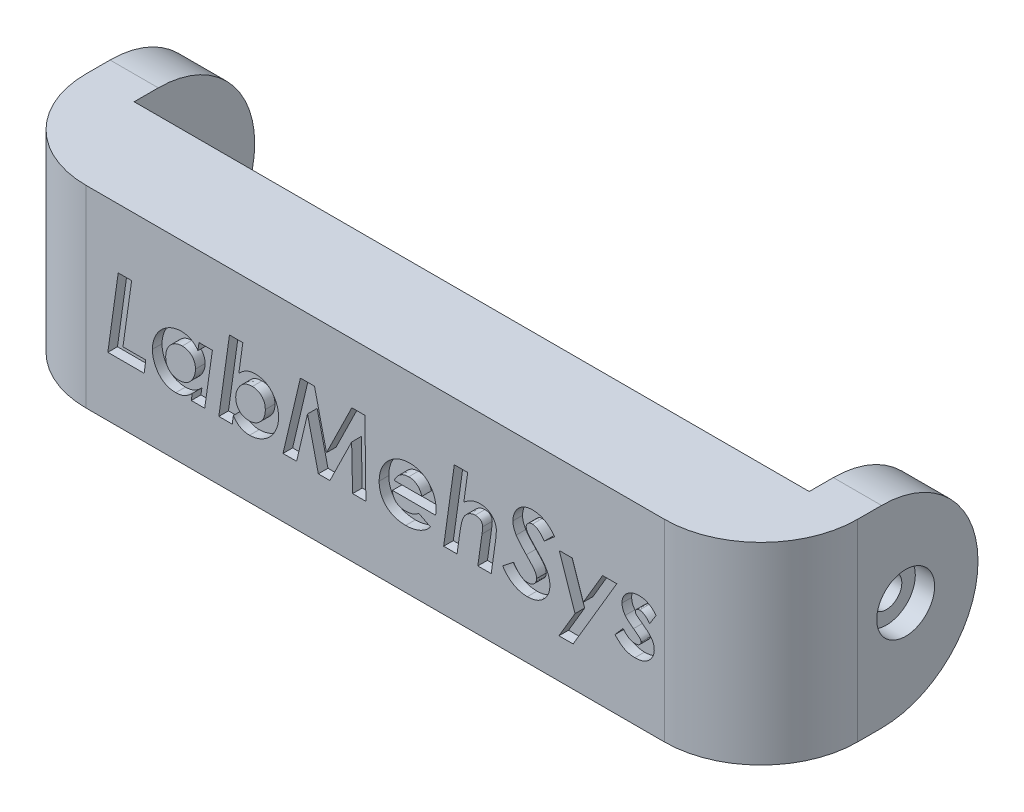
from build123d import *

# Parameters (mm, degrees)
SKETCH1_W           = 70
SKETCH1_H           = 10
BOSS_EXTRUDE1_DEPTH = 20
FILLET1_R           = 10
FILLET2_R           = 10
SKETCH4_R           = 1.6
CUT_EXTRUDE2_DEPTH  = 94
SKETCH5_R           = 3
CUT_EXTRUDE3_DEPTH  = 2
CUT_EXTRUDE4_START  = -2
SKETCH6_R           = 3
CUT_EXTRUDE4_DEPTH  = 2
CUT_EXTRUDE5_DEPTH  = 1


with BuildPart() as part:
    # Sketch1 → Boss-Extrude1 (new body)
    with BuildSketch(Plane(origin=(0, 0, 0), x_dir=(1, 0, 0), z_dir=(0, 1, 0))):
        Polygon((-34.024767802, -4.690402477), (-34.024767802, 5.309597523), (-34.024767802, 17.809597523), (-39.024767802, 17.809597523), (-39.024767802, -4.690402477), align=None)
        with Locations((0.975232198, 0.309597523)):
            Rectangle(SKETCH1_W, SKETCH1_H)
        Polygon((35.975232198, 17.809597523), (35.975232198, 5.309597523), (35.975232198, -4.690402477), (40.975232198, -4.690402477), (40.975232198, 17.809597523), align=None)
    extrude(amount=BOSS_EXTRUDE1_DEPTH)

    # Fillet1
    fillet1_edges = [part.edges().sort_by_distance(p)[0] for p in [
        (40.975232198, 10, 4.690402477),
        (-39.024767802, 10, 4.690402477),
    ]]
    fillet(fillet1_edges, radius=FILLET1_R)

    # Fillet2
    fillet2_edges = [part.edges().sort_by_distance(p)[0] for p in [
        (-36.524767802, 0, -17.809597523),
        (-36.524767802, 20, -17.809597523),
        (38.475232198, 0, -17.809597523),
        (38.475232198, 20, -17.809597523),
    ]]
    fillet(fillet2_edges, radius=FILLET2_R - 0.0001)  # a hair under: the kernel refuses the full size

    # Sketch4 → Cut-Extrude2 (cut)
    with BuildSketch(Plane(origin=(40.975232198, 0, 0), x_dir=(0, 0, -1), z_dir=(1, 0, 0))):
        with Locations((10.309597523, 10)):
            Circle(SKETCH4_R)
    extrude(amount=-CUT_EXTRUDE2_DEPTH, mode=Mode.SUBTRACT)

    # Sketch5 → Cut-Extrude3 (cut)
    with BuildSketch(Plane.ZY.offset(39.024767802)):
        with Locations((-10.309597523, 10)):
            Circle(SKETCH5_R)
    extrude(amount=-CUT_EXTRUDE3_DEPTH, mode=Mode.SUBTRACT)

    # Sketch6 → Cut-Extrude4 (cut)
    with BuildSketch(Plane(origin=(40.975232198, 0, 0), x_dir=(0, 0, -1), z_dir=(1, 0, 0)).offset(CUT_EXTRUDE4_START)):
        with Locations(Location((10.309597523, 10, 0), (0, 0, 180))):
            Circle(SKETCH6_R)
    extrude(amount=CUT_EXTRUDE4_DEPTH, mode=Mode.SUBTRACT)

    # Sketch7 → Cut-Extrude5 (cut)
    # profile 1 of 9: a face of its own
    with BuildSketch(Plane.XY.offset(4.690402477)):
        Polygon((-25.679774562, 13.80675238), (-24.288751007, 13.80675238), (-25.186383887, 7.412655158), (-22.820875323, 7.412655158), (-22.986875924, 6.133835714), (-26.755704383, 6.133835714), align=None)
    # profile 2 of 9: a face of its own
    with BuildSketch(Plane.XY.offset(4.690402477)):
        with BuildLine():
            Line((-17.302892383, 11.740967124), (-15.913405872, 11.740967124))
            Line((-15.913405872, 11.740967124), (-16.709593939, 6.133835714))
            Line((-16.709593939, 6.133835714), (-18.099080451, 6.133835714))
            Line((-18.099080451, 6.133835714), (-18.002246767, 6.819356714))
            add(Edge.make_bspline(
                [(-18.002246767, 6.819356714), (-18.074496335, 6.750584947), (-18.212263445, 6.619449386), (-18.425640223, 6.449322627), (-18.63104036, 6.310962019), (-18.833541739, 6.20484122), (-19.038706507, 6.127848867), (-19.251668172, 6.074521521), (-19.476757032, 6.04116968), (-19.630879939, 6.037398519), (-19.709901097, 6.035464987)],
                knots=[0, 0, 0, 0, 1.236324186, 2.357450916, 3.379388742, 4.30284698, 5.185433758, 6.089881904, 7.020653398, 8, 8, 8, 8], degree=3))
            add(Edge.make_bspline(
                [(-19.709901097, 6.035464987), (-19.80022409, 6.037569185), (-19.977116908, 6.041690146), (-20.235154703, 6.081568965), (-20.479092386, 6.143938585), (-20.709044832, 6.231944025), (-20.923769529, 6.346816129), (-21.125322243, 6.486068632), (-21.311880353, 6.651415752), (-21.480885291, 6.840670367), (-21.633301904, 7.044650699), (-21.765873624, 7.260198283), (-21.880988128, 7.482269972), (-21.970586977, 7.71492278), (-22.04454995, 7.953805634), (-22.094063524, 8.202104525), (-22.126003375, 8.458036711), (-22.130171758, 8.631432952), (-22.132280237, 8.71914137)],
                knots=[0, 0, 0, 0, 1.072254913, 2.099954687, 3.093402483, 4.05863531, 5.017013142, 5.979305845, 6.962352722, 7.970695896, 8.988290287, 9.983079422, 10.973839091, 11.95483031, 12.940586347, 13.940815436, 14.958409826, 16, 16, 16, 16], degree=3))
            add(Edge.make_bspline(
                [(-22.132280237, 8.71914137), (-22.131222283, 8.786820541), (-22.129117688, 8.921455148), (-22.108331259, 9.122278141), (-22.074462346, 9.320366441), (-22.027946165, 9.516377378), (-21.969964308, 9.710257212), (-21.897483006, 9.90130915), (-21.810539716, 10.089148502), (-21.712811407, 10.274000117), (-21.604940159, 10.453634515), (-21.483932772, 10.622237014), (-21.35690779, 10.782888938), (-21.219790704, 10.932440338), (-21.072927085, 11.070402997), (-20.919344383, 11.201127322), (-20.754097165, 11.31828006), (-20.58300429, 11.427979954), (-20.40507194, 11.523498469), (-20.225122221, 11.60933553), (-20.041765156, 11.679310534), (-19.85731304, 11.73854481), (-19.67015801, 11.783026969), (-19.481213889, 11.815000905), (-19.290258591, 11.836220276), (-19.162257296, 11.838297593), (-19.098158142, 11.839337851)],
                knots=[0, 0, 0, 0, 1.010861959, 2.01091412, 3.012605424, 4.011485121, 5.018863341, 6.033918867, 7.061452407, 8.109228878, 9.15680961, 10.18900835, 11.207521355, 12.215190347, 13.216881651, 14.216552911, 15.225616441, 16.240671966, 17.251099115, 18.240697123, 19.217272556, 20.180771028, 21.133199006, 22.08832996, 23.042693801, 24, 24, 24, 24], degree=3))
            add(Edge.make_bspline(
                [(-19.098158142, 11.839337851), (-19.012914431, 11.836909236), (-18.844886844, 11.832122088), (-18.598785865, 11.787246223), (-18.363025734, 11.716270037), (-18.138190032, 11.61784434), (-17.92704188, 11.492428227), (-17.735747171, 11.33794153), (-17.559983546, 11.1608642), (-17.463909731, 11.023694546), (-17.415096493, 10.954001312)],
                knots=[0, 0, 0, 0, 1.030509072, 2.031281277, 3.015697838, 4.003854478, 4.993584726, 5.977161716, 6.972235198, 8, 8, 8, 8], degree=3))
            Line((-17.415096493, 10.954001312), (-17.302892383, 11.740967124))
        make_face()
        with BuildLine():
            add(Edge.make_bspline(
                [(-19.400955534, 7.314284432), (-19.320831154, 7.316760961), (-19.164573661, 7.321590654), (-18.938823431, 7.364373922), (-18.728455632, 7.431746551), (-18.533788137, 7.528055869), (-18.354151491, 7.654722612), (-18.191093719, 7.812812236), (-18.043818113, 8.002192586), (-17.914659909, 8.217157997), (-17.806718547, 8.448351412), (-17.727631653, 8.687032819), (-17.677195812, 8.928620998), (-17.671533253, 9.09137846), (-17.668708523, 9.172568937)],
                knots=[0, 0, 0, 0, 1.017901168, 1.985097214, 2.910041334, 3.818973104, 4.735274743, 5.693545178, 6.695670165, 7.777101795, 8.875856117, 9.932619244, 10.968700869, 12, 12, 12, 12], degree=3))
            add(Edge.make_bspline(
                [(-17.668708523, 9.172568937), (-17.670000719, 9.223332908), (-17.672540168, 9.323095266), (-17.68913987, 9.468777569), (-17.718321072, 9.606782009), (-17.760191064, 9.737023331), (-17.813673689, 9.859641602), (-17.87916532, 9.974996291), (-17.955730796, 10.08227969), (-18.043736878, 10.181400165), (-18.142083922, 10.269216783), (-18.246359109, 10.349724824), (-18.361410113, 10.412943653), (-18.481660075, 10.468109756), (-18.610395035, 10.508802112), (-18.745863, 10.540507738), (-18.889756732, 10.556622976), (-18.987970904, 10.559200066), (-19.038213481, 10.560518406)],
                knots=[0, 0, 0, 0, 1.109141645, 2.179707075, 3.198451464, 4.18615572, 5.163657463, 6.116161664, 7.079133258, 8.038519567, 9.005387219, 9.956904198, 10.909408399, 11.866440704, 12.843493655, 13.853714903, 14.902043453, 16, 16, 16, 16], degree=3))
            add(Edge.make_bspline(
                [(-19.038213481, 10.560518406), (-19.096721006, 10.559241298), (-19.21222245, 10.556720122), (-19.381950436, 10.530681223), (-19.545653549, 10.491801949), (-19.701746807, 10.433620871), (-19.851858865, 10.361911465), (-19.993655584, 10.271311427), (-20.129893812, 10.166330873), (-20.257681027, 10.045973133), (-20.374238891, 9.912800861), (-20.476251925, 9.769135901), (-20.563063904, 9.615797474), (-20.633801144, 9.453025355), (-20.68735789, 9.280121985), (-20.72765601, 9.099321594), (-20.750865938, 8.908289452), (-20.753659351, 8.778123729), (-20.755090066, 8.711456157)],
                knots=[0, 0, 0, 0, 0.994897251, 1.964056203, 2.915642991, 3.853470011, 4.79324038, 5.741466074, 6.711095529, 7.716481674, 8.723680824, 9.71796663, 10.70964959, 11.717112863, 12.731868792, 13.785363818, 14.865719672, 16, 16, 16, 16], degree=3))
            add(Edge.make_bspline(
                [(-20.755090066, 8.711456157), (-20.753774807, 8.660187643), (-20.751202709, 8.559927807), (-20.735028696, 8.413008289), (-20.703531419, 8.274376853), (-20.66217161, 8.143130628), (-20.609995105, 8.019143225), (-20.545007865, 7.903172616), (-20.467636005, 7.795002261), (-20.378993822, 7.695511368), (-20.280287946, 7.606941182), (-20.17568616, 7.527357678), (-20.06294374, 7.461465647), (-19.943599631, 7.406978287), (-19.817216775, 7.365573766), (-19.68424316, 7.337005311), (-19.544986028, 7.317465625), (-19.449698364, 7.315361012), (-19.400955534, 7.314284432)],
                knots=[0, 0, 0, 0, 1.124431694, 2.198919568, 3.234766021, 4.236791382, 5.213425507, 6.179206721, 7.145706547, 8.12447102, 9.094881178, 10.04988442, 11.001776355, 11.952075609, 12.922030374, 13.911569148, 14.931697721, 16, 16, 16, 16], degree=3))
        make_face(mode=Mode.SUBTRACT)
    # profile 3 of 9: a face of its own
    with BuildSketch(Plane.XY.offset(4.690402477)):
        with BuildLine():
            Line((-13.856842871, 6.133835714), (-15.246329383, 6.133835714))
            Line((-15.246329383, 6.133835714), (-14.142732795, 14.003493833))
            Line((-14.142732795, 14.003493833), (-12.754783326, 14.003493833))
            Line((-12.754783326, 14.003493833), (-13.169784828, 11.04161274))
            add(Edge.make_bspline(
                [(-13.169784828, 11.04161274), (-13.097583069, 11.11245056), (-12.96012474, 11.247312209), (-12.747398647, 11.421836091), (-12.542905155, 11.562243461), (-12.341230493, 11.668857002), (-12.136131764, 11.744912397), (-11.923706654, 11.800810445), (-11.698818564, 11.833410708), (-11.545236177, 11.837333134), (-11.466741626, 11.839337851)],
                knots=[0, 0, 0, 0, 1.251006972, 2.381677804, 3.399685655, 4.315539795, 5.196231247, 6.100316428, 7.029089122, 8, 8, 8, 8], degree=3))
            add(Edge.make_bspline(
                [(-11.466741626, 11.839337851), (-11.376414942, 11.837265574), (-11.200021904, 11.833218761), (-10.942530517, 11.793067684), (-10.699127242, 11.730804496), (-10.469407062, 11.643288543), (-10.255757796, 11.527435265), (-10.054427373, 11.389296065), (-9.869372029, 11.222807066), (-9.700302057, 11.0342098), (-9.547957397, 10.830144033), (-9.415661296, 10.614951448), (-9.300413466, 10.39335795), (-9.208281222, 10.162054354), (-9.137534208, 9.922654196), (-9.086982638, 9.675846645), (-9.055236914, 9.420856698), (-9.051081645, 9.247977052), (-9.048973613, 9.160272596)],
                knots=[0, 0, 0, 0, 1.074461769, 2.098245705, 3.093738161, 4.060957578, 5.015928931, 5.980202173, 6.960712075, 7.971130566, 8.990819314, 9.98765587, 10.975026468, 11.960285364, 12.946317818, 13.942631884, 14.956266082, 16, 16, 16, 16], degree=3))
            add(Edge.make_bspline(
                [(-9.048973613, 9.160272596), (-9.049991509, 9.092587296), (-9.052016415, 8.957940498), (-9.073387007, 8.757292088), (-9.105064502, 8.558449073), (-9.151229933, 8.361694245), (-9.211574151, 8.167841211), (-9.284382701, 7.976582377), (-9.368447052, 7.78714411), (-9.466931314, 7.602318764), (-9.575349268, 7.422954419), (-9.693738228, 7.252787754), (-9.81969037, 7.091437638), (-9.956927985, 6.942976065), (-10.102124771, 6.803789423), (-10.255715953, 6.674298522), (-10.419566415, 6.55593666), (-10.590373881, 6.447386353), (-10.767204283, 6.350811032), (-10.946574567, 6.265886505), (-11.128686512, 6.195443546), (-11.311634537, 6.136258476), (-11.496773148, 6.091974474), (-11.683610899, 6.059644536), (-11.872551171, 6.038608256), (-11.999528341, 6.036513813), (-12.063114155, 6.035464987)],
                knots=[0, 0, 0, 0, 1.013451801, 2.016066107, 3.019062145, 4.027971124, 5.040172772, 6.057828882, 7.091818133, 8.14227902, 9.192543668, 10.229263228, 11.245616414, 12.255867067, 13.254567598, 14.256800029, 15.26222985, 16.27988596, 17.286164752, 18.278298122, 19.250221527, 20.208875209, 21.15628221, 22.098734397, 23.047911355, 24, 24, 24, 24], degree=3))
            add(Edge.make_bspline(
                [(-12.063114155, 6.035464987), (-12.148346332, 6.038509495), (-12.316917423, 6.044530882), (-12.564157794, 6.089718373), (-12.800277418, 6.166372501), (-13.024947946, 6.27054082), (-13.234946225, 6.403752445), (-13.423181017, 6.568660114), (-13.59699569, 6.755553809), (-13.690823646, 6.89978694), (-13.738490591, 6.973060974)],
                knots=[0, 0, 0, 0, 1.017645626, 2.01268628, 2.989956243, 3.975524875, 4.963465289, 5.948444836, 6.95775873, 8, 8, 8, 8], degree=3))
            Line((-13.738490591, 6.973060974), (-13.856842871, 6.133835714))
        make_face()
        with BuildLine():
            add(Edge.make_bspline(
                [(-11.771076061, 10.560518406), (-11.850642277, 10.557824378), (-12.005701375, 10.552574242), (-12.231133703, 10.512739691), (-12.440098162, 10.442417513), (-12.635110146, 10.347446525), (-12.81222, 10.219841252), (-12.975963543, 10.064721651), (-13.120974023, 9.875984886), (-13.251310127, 9.664715217), (-13.357385441, 9.436448943), (-13.437278172, 9.201888193), (-13.484998661, 8.963413913), (-13.49107697, 8.803370926), (-13.494100817, 8.723752497)],
                knots=[0, 0, 0, 0, 1.020631644, 1.989012793, 2.92445932, 3.841689372, 4.76099003, 5.714169008, 6.725443104, 7.805523698, 8.893656079, 9.947594549, 10.978966212, 12, 12, 12, 12], degree=3))
            add(Edge.make_bspline(
                [(-13.494100817, 8.723752497), (-13.492840055, 8.671959716), (-13.490374049, 8.570654849), (-13.473441137, 8.422487061), (-13.444847313, 8.282287942), (-13.40225307, 8.150465116), (-13.350638143, 8.025300192), (-13.285869516, 7.908477913), (-13.209413553, 7.79944324), (-13.122568582, 7.698856574), (-13.025725651, 7.607435851), (-12.919313927, 7.529594726), (-12.806380892, 7.462319159), (-12.685675789, 7.409398567), (-12.558756993, 7.364531995), (-12.423149828, 7.337254628), (-12.280931918, 7.317405182), (-12.183591442, 7.315340282), (-12.133818115, 7.314284432)],
                knots=[0, 0, 0, 0, 1.126186038, 2.20278045, 3.238531955, 4.232199798, 5.210951865, 6.178414309, 7.130420157, 8.102043749, 9.063714879, 10.019689469, 10.96364203, 11.916169311, 12.881576601, 13.884632073, 14.918344105, 16, 16, 16, 16], degree=3))
            add(Edge.make_bspline(
                [(-12.133818115, 7.314284432), (-12.075310576, 7.315544458), (-11.960316449, 7.318020988), (-11.791576093, 7.344053542), (-11.629060686, 7.383365409), (-11.473595497, 7.44064269), (-11.325024439, 7.513679183), (-11.18267578, 7.601220143), (-11.04832636, 7.707120711), (-10.921938215, 7.827719027), (-10.805549701, 7.960488388), (-10.703184734, 8.103691575), (-10.618522665, 8.25793748), (-10.547307331, 8.420169724), (-10.494189428, 8.592706563), (-10.453231322, 8.773361264), (-10.430582385, 8.96397675), (-10.427652771, 9.094124513), (-10.426163784, 9.160272596)],
                knots=[0, 0, 0, 0, 0.998366777, 1.962248238, 2.9086585, 3.849756023, 4.784937843, 5.731833278, 6.697935849, 7.700472628, 8.711184204, 9.708937404, 10.699800307, 11.710776929, 12.729071636, 13.777697986, 14.87050675, 16, 16, 16, 16], degree=3))
            add(Edge.make_bspline(
                [(-10.426163784, 9.160272596), (-10.42743222, 9.211550515), (-10.429912753, 9.311828746), (-10.44672994, 9.458508616), (-10.475834396, 9.597509389), (-10.51725627, 9.728972552), (-10.571608038, 9.852204078), (-10.636087603, 9.968637118), (-10.713608372, 10.076328264), (-10.801176357, 10.176105354), (-10.897430188, 10.266918553), (-11.002412376, 10.34523035), (-11.113859176, 10.412443682), (-11.23301422, 10.465448077), (-11.357501373, 10.509757249), (-11.489861401, 10.537801824), (-11.628063827, 10.557282327), (-11.722843351, 10.559426997), (-11.771076061, 10.560518406)],
                knots=[0, 0, 0, 0, 1.12759846, 2.205112442, 3.24149039, 4.246337781, 5.230184043, 6.198685213, 7.167907017, 8.141962875, 9.114453566, 10.072146408, 11.017028515, 11.970004121, 12.93561737, 13.916944341, 14.939945928, 16, 16, 16, 16], degree=3))
        make_face(mode=Mode.SUBTRACT)
    # profile 4 of 9: a face of its own
    with BuildSketch(Plane.XY.offset(4.690402477)):
        Polygon((-6.789520989, 13.80675238), (-5.32471939, 13.80675238), (-4.081251925, 8.460918212), (-1.455983162, 13.80675238), (-0.097237502, 13.80675238), (0.001133224, 6.133835714), (-1.376056947, 6.133835714), (-1.474427673, 10.723444922), (-3.727732127, 6.133835714), (-4.928162399, 6.133835714), (-6.048666455, 10.954001312), (-7.181466853, 6.133835714), (-8.592471961, 6.133835714), align=None)
    # profile 5 of 9: a face of its own
    with BuildSketch(Plane.XY.offset(4.690402477)):
        with BuildLine():
            Line((5.497597567, 7.792304681), (6.701101924, 7.174413555))
            add(Edge.make_bspline(
                [(6.701101924, 7.174413555), (6.630003717, 7.089346425), (6.487095964, 6.918361068), (6.230190473, 6.696752491), (5.942761021, 6.50031204), (5.623803212, 6.334196024), (5.279343429, 6.199644386), (4.913331754, 6.105992151), (4.529790938, 6.044611617), (4.267694397, 6.038550944), (4.13424078, 6.035464987)],
                knots=[0, 0, 0, 0, 0.914244933, 1.837636877, 2.790537697, 3.784087733, 4.800790172, 5.83726639, 6.89878507, 8, 8, 8, 8], degree=3))
            add(Edge.make_bspline(
                [(4.13424078, 6.035464987), (4.030125591, 6.037234593), (3.82746069, 6.040679209), (3.532013189, 6.076023048), (3.252815357, 6.129839459), (2.991286191, 6.208981366), (2.745197258, 6.3070125), (2.517584542, 6.430323363), (2.30696674, 6.576427872), (2.11332456, 6.741354444), (1.941257873, 6.926846427), (1.789551814, 7.126446221), (1.663103882, 7.342695656), (1.557596833, 7.571899148), (1.478342733, 7.817290339), (1.419357594, 8.075846552), (1.385824866, 8.349887809), (1.380863738, 8.53716948), (1.378323395, 8.633066984)],
                knots=[0, 0, 0, 0, 1.167516698, 2.272623801, 3.333371772, 4.353538571, 5.333382306, 6.300396664, 7.250661637, 8.204535574, 9.148031545, 10.083792083, 11.011414416, 11.952824574, 12.908912643, 13.898953575, 14.92416002, 16, 16, 16, 16], degree=3))
            add(Edge.make_bspline(
                [(1.378323395, 8.633066984), (1.380596744, 8.743388571), (1.385067832, 8.960362513), (1.431788556, 9.278304943), (1.503757464, 9.583660442), (1.604629614, 9.876256502), (1.737671779, 10.154785028), (1.895414008, 10.422475046), (2.08626128, 10.674527633), (2.301931269, 10.911586568), (2.537672233, 11.127541873), (2.787629336, 11.318425211), (3.050959698, 11.479350166), (3.325717332, 11.611739127), (3.613198689, 11.714555313), (3.912742008, 11.785583892), (4.223959399, 11.832505533), (4.435840417, 11.837041669), (4.543094112, 11.839337851)],
                knots=[0, 0, 0, 0, 1.05529311, 2.075487762, 3.068699193, 4.055083011, 5.031283693, 6.018666653, 7.023995929, 8.051577733, 9.082465902, 10.079966066, 11.057287041, 12.031169187, 12.994424047, 13.973330935, 14.974104677, 16, 16, 16, 16], degree=3))
            add(Edge.make_bspline(
                [(4.543094112, 11.839337851), (4.60818235, 11.837893253), (4.736485449, 11.835045635), (4.926598609, 11.820352822), (5.110566725, 11.791687246), (5.289701723, 11.755984263), (5.462522546, 11.706025924), (5.629975541, 11.645560133), (5.793789114, 11.577492231), (5.949907696, 11.494843011), (6.101152382, 11.405487302), (6.242655067, 11.302410026), (6.378044951, 11.192591741), (6.504960331, 11.072256016), (6.621451051, 10.940742505), (6.731435121, 10.80049841), (6.832301083, 10.649519412), (6.926083387, 10.490841822), (7.008180811, 10.324285398), (7.082872276, 10.155308972), (7.142007275, 9.980908208), (7.194166637, 9.804457619), (7.230923833, 9.622664486), (7.261955085, 9.438375736), (7.276079727, 9.250152327), (7.27906455, 9.123909947), (7.280566985, 9.060364827)],
                knots=[0, 0, 0, 0, 1.072343926, 2.113823519, 3.137889586, 4.13760148, 5.120645553, 6.097657508, 7.069516392, 8.039614793, 9.005002879, 9.960565349, 10.920144366, 11.87525951, 12.837543921, 13.811635494, 14.808779264, 15.826321551, 16.845367656, 17.865985152, 18.866871901, 19.876579391, 20.894541571, 21.919893521, 22.952961626, 24, 24, 24, 24], degree=3))
            add(Edge.make_bspline(
                [(7.280566985, 9.060364827), (7.279910008, 9.018339231), (7.278546558, 8.931121727), (7.268960776, 8.794661622), (7.251827351, 8.648098476), (7.236314951, 8.546946989), (7.228307536, 8.49473315)],
                knots=[0, 0, 0, 0, 0.886860648, 1.840539587, 2.885298471, 4, 4, 4, 4], degree=3))
            Line((7.228307536, 8.49473315), (2.755513566, 8.49473315))
            add(Edge.make_bspline(
                [(2.755513566, 8.49473315), (2.758448536, 8.450613859), (2.764173986, 8.364547298), (2.783502854, 8.239126214), (2.816370056, 8.121355465), (2.859727094, 8.010434149), (2.912054031, 7.905090951), (2.974904799, 7.805803785), (3.050992592, 7.715612978), (3.135975017, 7.631698785), (3.23070073, 7.556742388), (3.334756033, 7.492267505), (3.446291458, 7.43552809), (3.56806698, 7.392310756), (3.697340054, 7.356219811), (3.835368501, 7.332484433), (3.981684495, 7.31627114), (4.082445559, 7.31495895), (4.13424078, 7.314284432)],
                knots=[0, 0, 0, 0, 1.040300458, 2.029386266, 2.980027991, 3.911437883, 4.828060054, 5.744444316, 6.66911896, 7.598419554, 8.551199615, 9.504589747, 10.47513087, 11.489753162, 12.539789264, 13.630032591, 14.781741895, 16, 16, 16, 16], degree=3))
            add(Edge.make_bspline(
                [(4.13424078, 7.314284432), (4.197306572, 7.315922862), (4.322266164, 7.319169273), (4.507194155, 7.340160293), (4.686303121, 7.379645119), (4.860054466, 7.431790441), (5.029120059, 7.497338608), (5.190396276, 7.582065097), (5.348652222, 7.678255402), (5.447526224, 7.753964439), (5.497597567, 7.792304681)],
                knots=[0, 0, 0, 0, 1.027214308, 2.035339218, 3.025519259, 4.010199041, 4.987959988, 5.973205312, 6.973599434, 8, 8, 8, 8], degree=3))
        make_face()
        with BuildLine():
            add(Edge.make_bspline(
                [(5.805006087, 9.478440415), (5.777675008, 9.562887798), (5.725048579, 9.725492577), (5.610252423, 9.946234465), (5.470121268, 10.134839811), (5.304482769, 10.289954938), (5.116508512, 10.41075806), (4.909780574, 10.498129727), (4.684154769, 10.551950883), (4.527003925, 10.557610511), (4.446260428, 10.560518406)],
                knots=[0, 0, 0, 0, 1.131480038, 2.178682812, 3.159669316, 4.117470342, 5.058967564, 5.99670948, 6.970717055, 8, 8, 8, 8], degree=3))
            add(Edge.make_bspline(
                [(4.446260428, 10.560518406), (4.365482796, 10.55768161), (4.206149559, 10.552086052), (3.97465513, 10.495073021), (3.754123644, 10.407252088), (3.549324978, 10.281621973), (3.359766903, 10.126707108), (3.197066147, 9.9374629), (3.053678666, 9.722108613), (2.983648454, 9.561178997), (2.947643891, 9.478440415)],
                knots=[0, 0, 0, 0, 0.983432494, 1.939812791, 2.890131691, 3.868528921, 4.858194814, 5.863362488, 6.901492691, 8, 8, 8, 8], degree=3))
            Line((2.947643891, 9.478440415), (5.805006087, 9.478440415))
        make_face(mode=Mode.SUBTRACT)
    # profile 6 of 9: a face of its own
    with BuildSketch(Plane.XY.offset(4.690402477)):
        with BuildLine():
            Line((9.171129385, 14.003493833), (10.560615896, 14.003493833))
            Line((10.560615896, 14.003493833), (10.156373692, 11.123075998))
            add(Edge.make_bspline(
                [(10.156373692, 11.123075998), (10.223156806, 11.179986907), (10.354020261, 11.29150549), (10.560059179, 11.436931282), (10.767404978, 11.561190419), (10.976415626, 11.664323417), (11.189652916, 11.739862369), (11.40295077, 11.798479841), (11.618996854, 11.833344029), (11.763999466, 11.837342475), (11.836361256, 11.839337851)],
                knots=[0, 0, 0, 0, 1.126950258, 2.208291845, 3.235685472, 4.230852531, 5.197119324, 6.137681051, 7.070632387, 8, 8, 8, 8], degree=3))
            add(Edge.make_bspline(
                [(11.836361256, 11.839337851), (11.897372926, 11.837631049), (12.016650772, 11.834294252), (12.191278241, 11.814978841), (12.35673339, 11.778898794), (12.514731233, 11.730308621), (12.663366798, 11.664940342), (12.80504134, 11.588542758), (12.935901665, 11.494818392), (13.058453465, 11.389911488), (13.168064764, 11.273123229), (13.266336816, 11.150174692), (13.347891202, 11.018195843), (13.416254326, 10.87952334), (13.46863767, 10.732503087), (13.505304085, 10.578401322), (13.52713663, 10.417173418), (13.530171965, 10.30748643), (13.531719245, 10.251572843)],
                knots=[0, 0, 0, 0, 1.125569649, 2.200489218, 3.2347607, 4.245007566, 5.243919716, 6.225152204, 7.208384982, 8.206760563, 9.196105357, 10.158406127, 11.105034341, 12.051756892, 13.005294035, 13.977152713, 14.968841716, 16, 16, 16, 16], degree=3))
            add(Edge.make_bspline(
                [(13.531719245, 10.251572843), (13.530061214, 10.191100342), (13.526390123, 10.057206572), (13.510794832, 9.836076212), (13.479909737, 9.576047526), (13.455580407, 9.389263349), (13.442570774, 9.289384175)],
                knots=[0, 0, 0, 0, 0.750743129, 1.6622403, 2.749928862, 4, 4, 4, 4], degree=3))
            Line((13.442570774, 9.289384175), (12.998365462, 6.133835714))
            Line((12.998365462, 6.133835714), (11.608878951, 6.133835714))
            Line((11.608878951, 6.133835714), (12.043862007, 9.220217258))
            add(Edge.make_bspline(
                [(12.043862007, 9.220217258), (12.053350066, 9.290373483), (12.071057965, 9.421308523), (12.091792018, 9.603653888), (12.102747565, 9.758056024), (12.105597824, 9.851418521), (12.106880754, 9.893441917)],
                knots=[0, 0, 0, 0, 1.255630561, 2.343427635, 3.254360171, 4, 4, 4, 4], degree=3))
            add(Edge.make_bspline(
                [(12.106880754, 9.893441917), (12.104686392, 9.943865783), (12.100477911, 10.040571782), (12.063939415, 10.177244454), (11.998934739, 10.29389382), (11.911063653, 10.391811597), (11.798840689, 10.467622908), (11.665931379, 10.52351495), (11.511441106, 10.555033971), (11.402034464, 10.558628418), (11.344507623, 10.560518406)],
                knots=[0, 0, 0, 0, 1.050605419, 2.01491584, 2.918850053, 3.811536677, 4.733293049, 5.71961023, 6.800953799, 8, 8, 8, 8], degree=3))
            add(Edge.make_bspline(
                [(11.344507623, 10.560518406), (11.284786772, 10.558053936), (11.163691524, 10.553056759), (10.984261221, 10.505006807), (10.804619194, 10.431943345), (10.629313157, 10.329363912), (10.462358074, 10.203729574), (10.313857265, 10.052161053), (10.188103311, 9.876783452), (10.09856662, 9.712373147), (10.035485567, 9.56162274), (9.990047368, 9.424281398), (9.946247489, 9.263936864), (9.901596873, 9.081584616), (9.859248453, 8.876316756), (9.815909143, 8.648942014), (9.774747952, 8.398793226), (9.749754511, 8.224262295), (9.736761062, 8.133528138)],
                knots=[0, 0, 0, 0, 0.892286547, 1.809278636, 2.762036141, 3.789377712, 4.840069328, 5.881314312, 6.952050478, 8.060490889, 8.675788013, 9.39606915, 10.224080956, 11.163409914, 12.205755774, 13.360913367, 14.628006524, 16, 16, 16, 16], degree=3))
            Line((9.736761062, 8.133528138), (9.457019309, 6.133835714))
            Line((9.457019309, 6.133835714), (8.067532797, 6.133835714))
            Line((8.067532797, 6.133835714), (9.171129385, 14.003493833))
        make_face()
    # profile 7 of 9: a face of its own
    with BuildSketch(Plane.XY.offset(4.690402477)):
        with BuildLine():
            Line((19.572296669, 12.740044815), (18.505589104, 11.810134041))
            add(Edge.make_bspline(
                [(18.505589104, 11.810134041), (18.45227759, 11.882149675), (18.350107057, 12.02016631), (18.187983386, 12.205283807), (18.032662957, 12.366148682), (17.876210447, 12.49443151), (17.723713795, 12.596152366), (17.573844112, 12.669836871), (17.425758967, 12.716399698), (17.326980066, 12.72197024), (17.279029108, 12.724674389)],
                knots=[0, 0, 0, 0, 1.358515141, 2.603569235, 3.730126198, 4.746094498, 5.666493297, 6.504166865, 7.273866877, 8, 8, 8, 8], degree=3))
            add(Edge.make_bspline(
                [(17.279029108, 12.724674389), (17.233735332, 12.722713486), (17.146629365, 12.718942407), (17.021594544, 12.686791605), (16.907954223, 12.635075058), (16.810389455, 12.560260697), (16.728903478, 12.474002833), (16.668399037, 12.377205416), (16.633162033, 12.270513329), (16.628277676, 12.196698251), (16.625786002, 12.159042712)],
                knots=[0, 0, 0, 0, 1.130304997, 2.173727141, 3.204821236, 4.229135679, 5.225705988, 6.15679035, 7.05971714, 8, 8, 8, 8], degree=3))
            add(Edge.make_bspline(
                [(16.625786002, 12.159042712), (16.628055224, 12.121946705), (16.632828083, 12.043922605), (16.66779656, 11.925639255), (16.720691004, 11.801009682), (16.784311697, 11.692644107), (16.85574403, 11.594244785), (16.93060064, 11.497961787), (17.028343501, 11.382843625), (17.147280059, 11.247572292), (17.286274058, 11.091006448), (17.448930547, 10.915424148), (17.632320831, 10.719672243), (17.762579223, 10.58296176), (17.830827402, 10.511333043)],
                knots=[0, 0, 0, 0, 0.642317819, 1.35098826, 2.122816345, 2.986294386, 3.520967692, 4.229638134, 5.099348126, 6.137609051, 7.351336444, 8.727500291, 10.285391505, 12, 12, 12, 12], degree=3))
            add(Edge.make_bspline(
                [(17.830827402, 10.511333043), (17.86785029, 10.473034703), (17.93889002, 10.399547629), (18.038568172, 10.292222164), (18.127532971, 10.192751838), (18.209673231, 10.104620458), (18.27999055, 10.023277517), (18.340028274, 9.950674556), (18.390996676, 9.887833201), (18.421129729, 9.84841648), (18.434885144, 9.83042317)],
                knots=[0, 0, 0, 0, 1.403722598, 2.693470914, 3.859630393, 4.920438112, 5.867965235, 6.69256451, 7.40316977, 8, 8, 8, 8], degree=3))
            add(Edge.make_bspline(
                [(18.434885144, 9.83042317), (18.489660053, 9.754750965), (18.595304523, 9.608801839), (18.732333246, 9.386897016), (18.845671294, 9.173095968), (18.934732182, 8.964868383), (19.001355614, 8.75993676), (19.049608979, 8.554913578), (19.080004766, 8.348093457), (19.083375988, 8.208944132), (19.085054164, 8.139676309)],
                knots=[0, 0, 0, 0, 1.215130546, 2.343624586, 3.390252636, 4.360992906, 5.286454858, 6.190345157, 7.099163061, 8, 8, 8, 8], degree=3))
            add(Edge.make_bspline(
                [(19.085054164, 8.139676309), (19.082965868, 8.063224089), (19.07885609, 7.912765737), (19.047010357, 7.692015061), (18.997408171, 7.480350562), (18.923443787, 7.279043883), (18.832115828, 7.085904456), (18.716201239, 6.903760486), (18.582856413, 6.729530105), (18.428917466, 6.567329433), (18.260428819, 6.418997659), (18.076963311, 6.290547287), (17.883040427, 6.181060373), (17.676688835, 6.090923226), (17.458537342, 6.022366536), (17.228975124, 5.973604412), (16.988425953, 5.941236289), (16.823661091, 5.938494369), (16.739527154, 5.937094261)],
                knots=[0, 0, 0, 0, 1.018989505, 2.005376454, 2.968035412, 3.912365187, 4.859556873, 5.811049809, 6.78527381, 7.780773345, 8.787785161, 9.773320145, 10.761314359, 11.752515283, 12.770107012, 13.804505292, 14.878913802, 16, 16, 16, 16], degree=3))
            add(Edge.make_bspline(
                [(16.739527154, 5.937094261), (16.674937248, 5.938388447), (16.547075524, 5.940950409), (16.357561046, 5.957960556), (16.172641617, 5.98699909), (15.992588984, 6.02890385), (15.817027194, 6.081227897), (15.645682542, 6.144033942), (15.478983758, 6.22005334), (15.316717357, 6.307309356), (15.158868339, 6.406143247), (15.006383858, 6.517733906), (14.857618707, 6.639929412), (14.714522719, 6.77504405), (14.574074636, 6.919348185), (14.438734383, 7.076124572), (14.309861891, 7.246030298), (14.228053474, 7.364682729), (14.186499393, 7.424951499)],
                knots=[0, 0, 0, 0, 1.003438088, 1.986398949, 2.953471805, 3.909242729, 4.856156023, 5.798037682, 6.742035895, 7.700024963, 8.658509928, 9.632892881, 10.633707184, 11.647385023, 12.688779161, 13.761077638, 14.862753205, 16, 16, 16, 16], degree=3))
            Line((14.186499393, 7.424951499), (15.322373876, 8.317973251))
            add(Edge.make_bspline(
                [(15.322373876, 8.317973251), (15.3789501, 8.230980034), (15.487459701, 8.064132576), (15.664325345, 7.838918072), (15.84463913, 7.647510865), (16.029055772, 7.490655172), (16.218168576, 7.368609372), (16.410620029, 7.281370054), (16.60726664, 7.22525786), (16.740704588, 7.219020117), (16.807157029, 7.215913705)],
                knots=[0, 0, 0, 0, 1.289844872, 2.473840458, 3.555310637, 4.554525788, 5.477014656, 6.343795492, 7.175205895, 8, 8, 8, 8], degree=3))
            add(Edge.make_bspline(
                [(16.807157029, 7.215913705), (16.868470861, 7.218600803), (16.987829837, 7.223831746), (17.158572294, 7.272535439), (17.315222027, 7.347615335), (17.450839845, 7.454817633), (17.565088355, 7.580719572), (17.648136817, 7.724148838), (17.698134024, 7.881300435), (17.704571962, 7.990220542), (17.707863993, 8.04591671)],
                knots=[0, 0, 0, 0, 1.07813582, 2.098795369, 3.104167493, 4.120866408, 5.124778177, 6.083335831, 7.019916046, 8, 8, 8, 8], degree=3))
            add(Edge.make_bspline(
                [(17.707863993, 8.04591671), (17.706291309, 8.091186572), (17.703092179, 8.183273818), (17.669744298, 8.320427685), (17.620250527, 8.459501085), (17.560262624, 8.577039126), (17.49556178, 8.680104526), (17.42704295, 8.773437545), (17.340826614, 8.882988675), (17.234164888, 9.006186551), (17.111417791, 9.14719033), (16.967934427, 9.301044489), (16.808299162, 9.472840513), (16.693679639, 9.590382608), (16.633471215, 9.652126229)],
                knots=[0, 0, 0, 0, 0.82235112, 1.672813781, 2.554588539, 3.50524042, 4.06657461, 4.767804758, 5.610876414, 6.602916144, 7.732569792, 9.01260869, 10.430754915, 12, 12, 12, 12], degree=3))
            add(Edge.make_bspline(
                [(16.633471215, 9.652126229), (16.569746704, 9.718034304), (16.446557034, 9.845445152), (16.272276641, 10.031910081), (16.115291432, 10.205461533), (15.975779162, 10.366282125), (15.853624589, 10.514660949), (15.746714013, 10.64947237), (15.658283297, 10.772494751), (15.60840892, 10.852314607), (15.585208161, 10.889445523)],
                knots=[0, 0, 0, 0, 1.354401886, 2.618275412, 3.770529779, 4.811580489, 5.763301005, 6.60974666, 7.35327647, 8, 8, 8, 8], degree=3))
            add(Edge.make_bspline(
                [(15.585208161, 10.889445523), (15.533405286, 10.981970129), (15.432898767, 11.161483837), (15.329283997, 11.444021618), (15.261762317, 11.722929533), (15.252935557, 11.909164067), (15.248595831, 12.000727324)],
                knots=[0, 0, 0, 0, 1.081804801, 2.098888081, 3.065307629, 4, 4, 4, 4], degree=3))
            add(Edge.make_bspline(
                [(15.248595831, 12.000727324), (15.250154083, 12.059718135), (15.253253736, 12.177061878), (15.27556885, 12.350245806), (15.309736727, 12.519593182), (15.364205958, 12.682535301), (15.427024692, 12.843152241), (15.509136577, 12.99722363), (15.60138958, 13.148894483), (15.675401317, 13.242851068), (15.712782697, 13.290306066)],
                knots=[0, 0, 0, 0, 1.012167245, 2.013389743, 2.992947912, 3.971795425, 4.958040075, 5.949133471, 6.964161297, 8, 8, 8, 8], degree=3))
            add(Edge.make_bspline(
                [(15.712782697, 13.290306066), (15.762129356, 13.347498483), (15.859458753, 13.46030254), (16.027857085, 13.604498184), (16.206406143, 13.729050416), (16.398949291, 13.829040754), (16.603272447, 13.908734215), (16.821318874, 13.962811566), (17.051417497, 13.99814007), (17.20921364, 14.00168414), (17.289788406, 14.003493833)],
                knots=[0, 0, 0, 0, 1.010152455, 1.992384693, 2.959065588, 3.919519142, 4.890305168, 5.888624478, 6.921877408, 8, 8, 8, 8], degree=3))
            add(Edge.make_bspline(
                [(17.289788406, 14.003493833), (17.401210974, 13.999603907), (17.621008294, 13.991930457), (17.94436277, 13.93228878), (18.252500718, 13.831191041), (18.548503872, 13.693833352), (18.827566092, 13.512941214), (19.093414346, 13.294275959), (19.345901934, 13.036278994), (19.495425733, 12.840629304), (19.572296669, 12.740044815)],
                knots=[0, 0, 0, 0, 0.984438778, 1.941949542, 2.894274057, 3.844399604, 4.817935388, 5.825099055, 6.88187249, 8, 8, 8, 8], degree=3))
        make_face()
    # profile 8 of 9: a face of its own
    with BuildSketch(Plane.XY.offset(4.690402477)):
        Polygon((20.056465089, 11.740967124), (21.399840322, 11.740967124), (22.54493706, 8.342565932), (24.550777655, 11.740967124), (26.020190382, 11.740967124), (21.490525836, 4.068050457), (20.021113109, 4.068050457), (21.690341374, 6.893134759), align=None)
    # profile 9 of 9: a face of its own
    with BuildSketch(Plane.XY.offset(4.690402477)):
        with BuildLine():
            Line((30.082593978, 10.909427077), (29.429350872, 9.855015852))
            add(Edge.make_bspline(
                [(29.429350872, 9.855015852), (29.38775944, 9.912100021), (29.307692929, 10.021991169), (29.176929744, 10.169202313), (29.04170401, 10.291261933), (28.90392457, 10.388931792), (28.767877287, 10.463919193), (28.63580461, 10.519326857), (28.507337437, 10.553725694), (28.422263522, 10.558302996), (28.381087818, 10.560518406)],
                knots=[0, 0, 0, 0, 1.293875212, 2.490803217, 3.601185646, 4.625026071, 5.578970932, 6.442087991, 7.245971894, 8, 8, 8, 8], degree=3))
            add(Edge.make_bspline(
                [(28.381087818, 10.560518406), (28.351283662, 10.559363788), (28.293121272, 10.557110566), (28.209107241, 10.538772487), (28.132660881, 10.505993324), (28.066526229, 10.461703588), (28.010153448, 10.411819358), (27.970146164, 10.355965029), (27.942244228, 10.297045561), (27.939694442, 10.25545877), (27.938419549, 10.234665375)],
                knots=[0, 0, 0, 0, 1.182476273, 2.30758579, 3.391877461, 4.463697876, 5.456992938, 6.360200449, 7.180100224, 8, 8, 8, 8], degree=3))
            add(Edge.make_bspline(
                [(27.938419549, 10.234665375), (27.939472889, 10.214485188), (27.941630754, 10.173144224), (27.964513531, 10.112676734), (27.993872717, 10.050073216), (28.024114795, 10.012774323), (28.039864361, 9.993349686)],
                knots=[0, 0, 0, 0, 0.903144459, 1.85017425, 2.880406844, 4, 4, 4, 4], degree=3))
            add(Edge.make_bspline(
                [(28.039864361, 9.993349686), (28.049915426, 9.981886549), (28.072883514, 9.955691679), (28.117126216, 9.91627772), (28.172425429, 9.868607198), (28.239720888, 9.813286961), (28.320201641, 9.752657035), (28.410619627, 9.682264091), (28.515702763, 9.607869732), (28.589624936, 9.55530558), (28.628551677, 9.527625778)],
                knots=[0, 0, 0, 0, 0.486262068, 1.111176692, 1.888157049, 2.817936484, 3.890888726, 5.104451828, 6.475230771, 8, 8, 8, 8], degree=3))
            add(Edge.make_bspline(
                [(28.628551677, 9.527625778), (28.691321321, 9.482901511), (28.812429502, 9.396610205), (28.983250933, 9.266020221), (29.136541084, 9.139873069), (29.274978159, 9.020518923), (29.393931201, 8.902996885), (29.499765018, 8.793661497), (29.586200486, 8.686548019), (29.680092925, 8.553298497), (29.769307046, 8.38274169), (29.849825602, 8.172234531), (29.897024766, 7.95167692), (29.902882917, 7.801743716), (29.905834079, 7.726211849)],
                knots=[0, 0, 0, 0, 1.202285104, 2.319697097, 3.353301761, 4.299159753, 5.169575473, 5.96111865, 6.671375532, 7.314364668, 8.50149111, 9.6623909, 10.822382393, 12, 12, 12, 12], degree=3))
            add(Edge.make_bspline(
                [(29.905834079, 7.726211849), (29.904493009, 7.675894292), (29.901808363, 7.575165205), (29.875744066, 7.425871184), (29.836057783, 7.278295477), (29.778088609, 7.133561537), (29.705700185, 6.989680252), (29.616099835, 6.848546402), (29.510440517, 6.709522869), (29.391008087, 6.573500439), (29.254489251, 6.447736996), (29.103750247, 6.335975165), (28.936757169, 6.243773885), (28.756516233, 6.165817533), (28.559928867, 6.109011251), (28.350464494, 6.065078963), (28.125970323, 6.041254993), (27.971772794, 6.037434071), (27.892308271, 6.035464987)],
                knots=[0, 0, 0, 0, 0.823882478, 1.649303646, 2.476260642, 3.324427264, 4.199309487, 5.112434692, 6.059514339, 7.058678777, 8.074738792, 9.095747378, 10.125726673, 11.194005657, 12.30701197, 13.472823075, 14.697638618, 16, 16, 16, 16], degree=3))
            add(Edge.make_bspline(
                [(27.892308271, 6.035464987), (27.799941599, 6.038081032), (27.618344072, 6.043224307), (27.352414862, 6.085019456), (27.099883969, 6.157172849), (26.897460374, 6.237843987), (26.739485391, 6.319358629), (26.619587155, 6.39475043), (26.494645719, 6.478686364), (26.367665045, 6.576116657), (26.236391411, 6.68424323), (26.101858674, 6.80347752), (25.964354979, 6.935136583), (25.873392276, 7.028128169), (25.826523015, 7.076042829)],
                knots=[0, 0, 0, 0, 1.3917013, 2.736154834, 4.044007326, 5.343168153, 6.013207005, 6.720436798, 7.476485983, 8.281134576, 9.131434638, 10.039487272, 10.989830126, 12, 12, 12, 12], degree=3))
            Line((25.826523015, 7.076042829), (26.673433488, 8.050527838))
            add(Edge.make_bspline(
                [(26.673433488, 8.050527838), (26.721232613, 7.992381559), (26.813909405, 7.879642872), (26.962729425, 7.728504303), (27.11563894, 7.601195992), (27.272251851, 7.497057316), (27.431628022, 7.414466777), (27.595803249, 7.35751749), (27.762485453, 7.31966368), (27.87571018, 7.316076434), (27.932271379, 7.314284432)],
                knots=[0, 0, 0, 0, 1.194983961, 2.316931099, 3.362897671, 4.349081709, 5.298844883, 6.204687641, 7.103155112, 8, 8, 8, 8], degree=3))
            add(Edge.make_bspline(
                [(27.932271379, 7.314284432), (27.975454817, 7.315440921), (28.057992855, 7.31765136), (28.174624451, 7.343030256), (28.27846816, 7.382341944), (28.365982233, 7.439626958), (28.436740021, 7.507340147), (28.491162829, 7.580759784), (28.52206672, 7.663506981), (28.526425151, 7.720336928), (28.528643908, 7.749267488)],
                knots=[0, 0, 0, 0, 1.262863261, 2.413755393, 3.478337955, 4.49818724, 5.453495978, 6.336264993, 7.153038342, 8, 8, 8, 8], degree=3))
            add(Edge.make_bspline(
                [(28.528643908, 7.749267488), (28.527109916, 7.773027172), (28.523940331, 7.822120205), (28.498439486, 7.894936598), (28.461924253, 7.969954642), (28.415488406, 8.031180237), (28.368001863, 8.085005642), (28.317721632, 8.132803101), (28.254680759, 8.187574772), (28.17929148, 8.250540554), (28.091361455, 8.32151221), (27.990254194, 8.399894476), (27.874593318, 8.483764435), (27.793434073, 8.542395244), (27.750900352, 8.573122322)],
                knots=[0, 0, 0, 0, 0.730705261, 1.509807026, 2.357288366, 3.29541125, 3.865889586, 4.569470673, 5.431105645, 6.440057403, 7.596752151, 8.913931468, 10.38266143, 12, 12, 12, 12], degree=3))
            add(Edge.make_bspline(
                [(27.750900352, 8.573122322), (27.701052977, 8.609294068), (27.604178771, 8.679590834), (27.466431638, 8.784688414), (27.341676476, 8.887148096), (27.227244371, 8.983201032), (27.126199924, 9.077056931), (27.036265633, 9.166102272), (26.959177101, 9.25177689), (26.91443417, 9.309620512), (26.89323058, 9.337032495)],
                knots=[0, 0, 0, 0, 1.282428707, 2.492293047, 3.606974981, 4.643787634, 5.602579517, 6.477648517, 7.278560515, 8, 8, 8, 8], degree=3))
            add(Edge.make_bspline(
                [(26.89323058, 9.337032495), (26.842723549, 9.410974593), (26.744279926, 9.555095679), (26.638828268, 9.790067094), (26.574355993, 10.031928568), (26.56560069, 10.195857029), (26.561229378, 10.277702567)],
                knots=[0, 0, 0, 0, 1.057832104, 2.061828311, 3.032317477, 4, 4, 4, 4], degree=3))
            add(Edge.make_bspline(
                [(26.561229378, 10.277702567), (26.562361494, 10.334181408), (26.56458721, 10.445217564), (26.59230239, 10.606825388), (26.633111267, 10.760812715), (26.692572666, 10.905771735), (26.766165372, 11.044487924), (26.859788142, 11.173211615), (26.96742601, 11.295746465), (27.092055291, 11.407098769), (27.228028807, 11.506536508), (27.369338944, 11.597780332), (27.519769511, 11.670620926), (27.674681635, 11.732541139), (27.835668399, 11.78065752), (28.002955059, 11.813777017), (28.176026744, 11.836712469), (28.293912784, 11.838457146), (28.353421051, 11.839337851)],
                knots=[0, 0, 0, 0, 1.021630065, 2.008502182, 2.960568009, 3.90126412, 4.839440403, 5.797185411, 6.776483436, 7.788164727, 8.816178467, 9.825218622, 10.829341502, 11.837229321, 12.844091735, 13.866690309, 14.923116238, 16, 16, 16, 16], degree=3))
            add(Edge.make_bspline(
                [(28.353421051, 11.839337851), (28.437108182, 11.836210448), (28.604123944, 11.82996904), (28.851473936, 11.784839834), (29.091378282, 11.70636429), (29.323082256, 11.600502643), (29.543033454, 11.467811991), (29.743561477, 11.305737061), (29.92748463, 11.121346041), (30.030535415, 10.980552363), (30.082593978, 10.909427077)],
                knots=[0, 0, 0, 0, 0.983198209, 1.962184592, 2.942724805, 3.942248462, 4.950006518, 5.952318655, 6.965564907, 8, 8, 8, 8], degree=3))
        make_face()
    extrude(amount=-CUT_EXTRUDE5_DEPTH, mode=Mode.SUBTRACT)


solid = part.part
